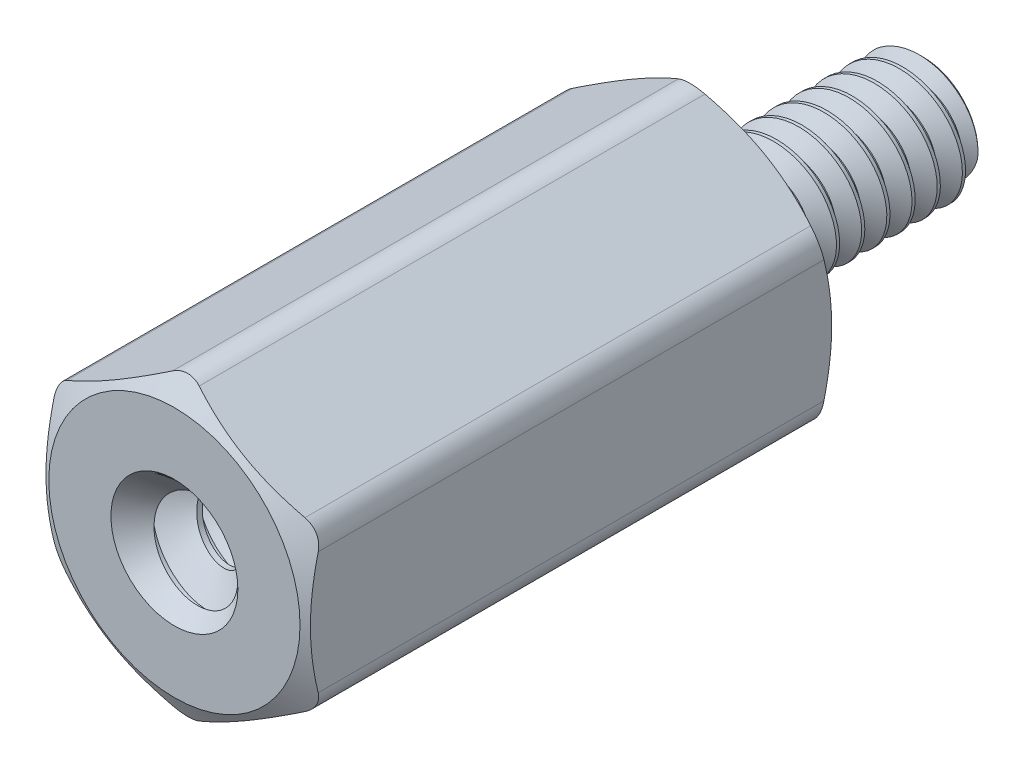
from build123d import *

# Parameters (mm, degrees)
SKETCH4_R           = 1.736725
BOSS_EXTRUDE1_DEPTH = 9.525
SKETCH5_OUTSIDE_W   = 61.704
SKETCH5_OUTSIDE_H   = 62.442
SKETCH5_OUTSIDE_R   = 2.2621875
CUT_EXTRUDE1_DEPTH  = 14.975410884
CUT_EXTRUDE1_DRAFT  = -60
SKETCH6_OUTSIDE_W   = 48.612
SKETCH6_OUTSIDE_H   = 49.35
SKETCH6_OUTSIDE_R   = 2.2621875
CUT_EXTRUDE2_DEPTH  = 11.195903359
CUT_EXTRUDE2_DRAFT  = -60
FILLET1_R           = 0.47625
CUT_SWEEP1_PITCH    = 0.453571429
SKETCH9_R           = 1.205592857
BOSS_EXTRUDE2_DEPTH = 4.7752
SKETCH10_W          = 4.7752
SKETCH10_H          = 1.0922
CUT_SWEEP2_PITCH    = 0.79375


with BuildPart() as part:
    # Sketch3 → Revolve1 (revolve)
    with BuildSketch(Plane(origin=(0, 0, 0), x_dir=(0, 0, -1), z_dir=(1, 0, 0))):
        with BuildLine():
            Line((-4.7498, 0.978807143), (-4.7498, 0))
            Line((-4.7498, 0), (3.96875, 0))
            Line((3.96875, 0), (3.96875, 0.978807143))
            Line((3.96875, 0.978807143), (3.855357143, 1.0922))
            Line((3.855357143, 1.0922), (0.646339286, 1.0922))
            Line((0.646339286, 1.0922), (0.47625, 0.797596715))
            Line((0.47625, 0.797596715), (0.113392857, 0.797596715))
            ThreePointArc((0.113392857, 0.797596715), (0.033211999, 0.830808714), (0, 0.910989572))
            Line((0, 0.910989572), (0, 2.38125))
            Line((0, 2.38125), (-9.525, 2.38125))
            Line((-9.525, 2.38125), (-9.525, 1.205592857))
            Line((-9.525, 1.205592857), (-9.411607143, 1.0922))
            Line((-9.411607143, 1.0922), (-4.863192857, 1.0922))
            Line((-4.863192857, 1.0922), (-4.7498, 0.978807143))
        make_face()
    revolve(axis=Axis((0, 0, -3.96875), (0, 0, 1)))

    # Sketch4 → Boss-Extrude1 (add)
    with BuildSketch(Plane.XY.offset(9.525)):
        Polygon((-2.38125, 1.374815329), (-2.38125, -1.374815329), (0, -2.749630657), (2.38125, -1.374815329), (2.38125, 1.374815329), (0, 2.749630657), align=None)
        Circle(SKETCH4_R, mode=Mode.SUBTRACT)
    extrude(amount=-BOSS_EXTRUDE1_DEPTH)


with BuildPart() as cut_extrude1_tool:
    # Sketch5 outside → Cut-Extrude1 (with draft: the straight prism first)
    with BuildSketch(Plane.XY.offset(9.525)):
        Rectangle(SKETCH5_OUTSIDE_W, SKETCH5_OUTSIDE_H)
        Circle(SKETCH5_OUTSIDE_R, mode=Mode.SUBTRACT)
    extrude(amount=-CUT_EXTRUDE1_DEPTH)
    # Cut-Extrude1: the draft: its side faces are tilted about the plane it starts from
    cut_extrude1_sides = [cut_extrude1_tool.faces().sort_by_distance(p)[0] for p in [
        (0, -31.221, 2.037294558),
        (30.852, 0, 2.037294558),
        (0, 31.221, 2.037294558),
        (-30.852, 0, 2.037294558),
        (-2.2621875, 0, 2.037294558),
    ]]
    draft(cut_extrude1_sides, Plane.XY.offset(9.525), CUT_EXTRUDE1_DRAFT)


with BuildPart() as part_1:
    add(part.part)

    # Cut-Extrude1: cut by cut_extrude1_tool
    add(cut_extrude1_tool.part, mode=Mode.SUBTRACT)


with BuildPart() as cut_extrude2_tool:
    # Sketch6 outside → Cut-Extrude2 (with draft: the straight prism first)
    with BuildSketch(Plane(origin=(0, 0, 0), x_dir=(-1, 0, 0), z_dir=(0, 0, -1))):
        Rectangle(SKETCH6_OUTSIDE_W, SKETCH6_OUTSIDE_H)
        Circle(SKETCH6_OUTSIDE_R, mode=Mode.SUBTRACT)
    extrude(amount=-CUT_EXTRUDE2_DEPTH)
    # Cut-Extrude2: the draft: its side faces are tilted about the plane it starts from
    cut_extrude2_sides = [cut_extrude2_tool.faces().sort_by_distance(p)[0] for p in [
        (0, -24.675, 5.59795168),
        (-24.306, 0, 5.59795168),
        (0, 24.675, 5.59795168),
        (24.306, 0, 5.59795168),
        (2.2621875, 0, 5.59795168),
    ]]
    draft(cut_extrude2_sides, Plane(origin=(0, 0, 0), x_dir=(-1, 0, 0), z_dir=(0, 0, -1)), CUT_EXTRUDE2_DRAFT)


with BuildPart() as part_2:
    add(part_1.part)

    # Cut-Extrude2: cut by cut_extrude2_tool
    add(cut_extrude2_tool.part, mode=Mode.SUBTRACT)

    # Fillet1
    fillet1_edges = [part_2.edges().sort_by_distance(p)[0] for p in [
        (0, 2.749630657, 4.7625),
        (-2.38125, -1.374815329, 4.7625),
        (0, -2.749630657, 4.7625),
        (2.38125, -1.374815329, 4.7625),
        (2.38125, 1.374815329, 4.7625),
        (-2.38125, 1.374815329, 4.7625),
    ]]
    fillet(fillet1_edges, radius=FILLET1_R)

    # Cut-Sweep1: the profile of Sketch7 profile screwed along a right-hand helix of 8.4875 turns, 6 arcs to a turn; built about Z, then put on its axis
    cut_sweep1_z = Axis((0, 0, 0), (0, 0, 1))
    cut_sweep1_corners = [(0.797296715, 0, -0.170262491), (0.797296715, 0, -0.226612509), (1.116750274, 0, -0.411049107), (1.116750274, 0, 0.014174107)]
    with BuildLine(mode=Mode.PRIVATE) as cut_sweep1_profile:
        Line(cut_sweep1_corners[0], cut_sweep1_corners[1])
        Line(cut_sweep1_corners[1], cut_sweep1_corners[2])
        Line(cut_sweep1_corners[2], cut_sweep1_corners[3])
        Line(cut_sweep1_corners[3], cut_sweep1_corners[0])
    cut_sweep1_cap = Face(cut_sweep1_profile.wire())
    cut_sweep1_turn_angles = [0, 30, 60, 90, 120, 150, 180, 210, 240, 270, 300, 330, 360]
    cut_sweep1_turn_weights = [1, 0.8660254037844387, 1, 0.8660254037844387, 1, 0.8660254037844387, 1, 0.8660254037844387, 1, 0.8660254037844387, 1, 0.8660254037844387, 1]
    cut_sweep1_turn_rails = [Edge.make_bspline([Vector(p[0], p[1], 0).rotate(cut_sweep1_z, cut_sweep1_turn_angles[k]) / cut_sweep1_turn_weights[k] + Vector(0, 0, p[2] + CUT_SWEEP1_PITCH * cut_sweep1_turn_angles[k] / 360) for k in range(13)], [0, 0, 0, 1, 1, 2, 2, 3, 3, 4, 4, 5, 5, 6, 6, 6], 2, cut_sweep1_turn_weights) for p in cut_sweep1_corners]
    cut_sweep1_turn_sides = [Face.make_surface_from_curves(cut_sweep1_turn_rails[p[0]], cut_sweep1_turn_rails[p[1]]) for p in [(0, 1), (1, 2), (2, 3), (3, 0)]]
    cut_sweep1_last_angles = [2880, 2910, 2940, 2970, 3000, 3027.75, 3055.5]
    cut_sweep1_last_weights = [1, 0.8660254037844387, 1, 0.8660254037844387, 1, 0.884987637463125, 1]
    cut_sweep1_last_rails = [Edge.make_bspline([Vector(p[0], p[1], 0).rotate(cut_sweep1_z, cut_sweep1_last_angles[k]) / cut_sweep1_last_weights[k] + Vector(0, 0, p[2] + CUT_SWEEP1_PITCH * cut_sweep1_last_angles[k] / 360) for k in range(7)], [0, 0, 0, 1, 1, 2, 2, 3, 3, 3], 2, cut_sweep1_last_weights) for p in cut_sweep1_corners]
    cut_sweep1_last_sides = [Face.make_surface_from_curves(cut_sweep1_last_rails[p[0]], cut_sweep1_last_rails[p[1]]) for p in [(0, 1), (1, 2), (2, 3), (3, 0)]]
    cut_sweep1 = Plane(origin=(0, 0, -3.96875), x_dir=(0, 1, 0), z_dir=(0, 0, 1)) * Solid(Shell([*[p.moved(Location((0, 0, CUT_SWEEP1_PITCH * i))) for i in range(8) for p in cut_sweep1_turn_sides], *cut_sweep1_last_sides, cut_sweep1_cap, cut_sweep1_cap.rotate(cut_sweep1_z, 3055.5).moved(Location((0, 0, CUT_SWEEP1_PITCH * 3055.5 / 360)))]))
    add(cut_sweep1, mode=Mode.SUBTRACT)

    # Sketch9 → Boss-Extrude2 (add)
    with BuildSketch(Plane.XY.offset(4.7498)):
        Circle(SKETCH9_R)
    extrude(amount=BOSS_EXTRUDE2_DEPTH)


with BuildPart() as body_2:
    # Sketch10 → Revolve2 (revolve)
    with BuildSketch(Plane(origin=(0, 0, 0), x_dir=(0, 0, -1), z_dir=(1, 0, 0))):
        with Locations((-7.1374, 0.5461)):
            Rectangle(SKETCH10_W, SKETCH10_H)
    revolve(axis=Axis((0, 0, -3.96875), (0, 0, 1)))

    # Cut-Sweep2: the profile of Sketch12 screwed along a right-hand helix of 7.016 turns, 8 arcs to a turn; built about Z, then put on its axis
    cut_sweep2_z = Axis((0, 0, 0), (0, 0, 1))
    cut_sweep2_corners = [(0.576644252, 0, -0.396875), (0.576644252, 0, -0.29765625), (1.135162979, 0, 0.024804687), (1.135162979, 0, -0.719335937)]
    with BuildLine(mode=Mode.PRIVATE) as cut_sweep2_profile:
        Line(cut_sweep2_corners[0], cut_sweep2_corners[1])
        Line(cut_sweep2_corners[1], cut_sweep2_corners[2])
        Line(cut_sweep2_corners[2], cut_sweep2_corners[3])
        Line(cut_sweep2_corners[3], cut_sweep2_corners[0])
    cut_sweep2_cap = Face(cut_sweep2_profile.wire())
    cut_sweep2_turn_angles = [0, 22.5, 45, 67.5, 90, 112.5, 135, 157.5, 180, 202.5, 225, 247.5, 270, 292.5, 315, 337.5, 360]
    cut_sweep2_turn_weights = [1, 0.9238795325112867, 1, 0.9238795325112867, 1, 0.9238795325112867, 1, 0.9238795325112867, 1, 0.9238795325112867, 1, 0.9238795325112867, 1, 0.9238795325112867, 1, 0.9238795325112867, 1]
    cut_sweep2_turn_rails = [Edge.make_bspline([Vector(p[0], p[1], 0).rotate(cut_sweep2_z, cut_sweep2_turn_angles[k]) / cut_sweep2_turn_weights[k] + Vector(0, 0, p[2] + CUT_SWEEP2_PITCH * cut_sweep2_turn_angles[k] / 360) for k in range(17)], [0, 0, 0, 1, 1, 2, 2, 3, 3, 4, 4, 5, 5, 6, 6, 7, 7, 8, 8, 8], 2, cut_sweep2_turn_weights) for p in cut_sweep2_corners]
    cut_sweep2_turn_sides = [Face.make_surface_from_curves(cut_sweep2_turn_rails[p[0]], cut_sweep2_turn_rails[p[1]]) for p in [(0, 1), (1, 2), (2, 3), (3, 0)]]
    cut_sweep2_last_angles = [2520, 2522.88, 2525.76]
    cut_sweep2_last_weights = [1, 0.9987369566060154, 1]
    cut_sweep2_last_rails = [Edge.make_bspline([Vector(p[0], p[1], 0).rotate(cut_sweep2_z, cut_sweep2_last_angles[k]) / cut_sweep2_last_weights[k] + Vector(0, 0, p[2] + CUT_SWEEP2_PITCH * cut_sweep2_last_angles[k] / 360) for k in range(3)], [0, 0, 0, 1, 1, 1], 2, cut_sweep2_last_weights) for p in cut_sweep2_corners]
    cut_sweep2_last_sides = [Face.make_surface_from_curves(cut_sweep2_last_rails[p[0]], cut_sweep2_last_rails[p[1]]) for p in [(0, 1), (1, 2), (2, 3), (3, 0)]]
    cut_sweep2 = Plane(origin=(0, 0, 9.525), x_dir=(0, 1, 0), z_dir=(0, 0, -1)) * Solid(Shell([*[p.moved(Location((0, 0, CUT_SWEEP2_PITCH * i))) for i in range(7) for p in cut_sweep2_turn_sides], *cut_sweep2_last_sides, cut_sweep2_cap, cut_sweep2_cap.rotate(cut_sweep2_z, 2525.76).moved(Location((0, 0, CUT_SWEEP2_PITCH * 2525.76 / 360)))]))
    add(cut_sweep2, mode=Mode.SUBTRACT)


with BuildPart() as part_3:
    add(part_2.part)

    # Combine1: cut body 2
    add(body_2.part, mode=Mode.SUBTRACT)

    # Cut-Extrude3 cone 1 section (through the dimple's axis) → Cut-Extrude3 (revolve, cut)
    with BuildSketch(Plane(origin=(0, 0, 9.525), x_dir=(0, -1, 0), z_dir=(1, 0, 0))):
        Polygon((0, 0), (1.143, 0), (0, 1.143), align=None)
    revolve(axis=Axis((0, 0, 9.525), (0, 0, -1)), mode=Mode.SUBTRACT)


solid = part_3.part
